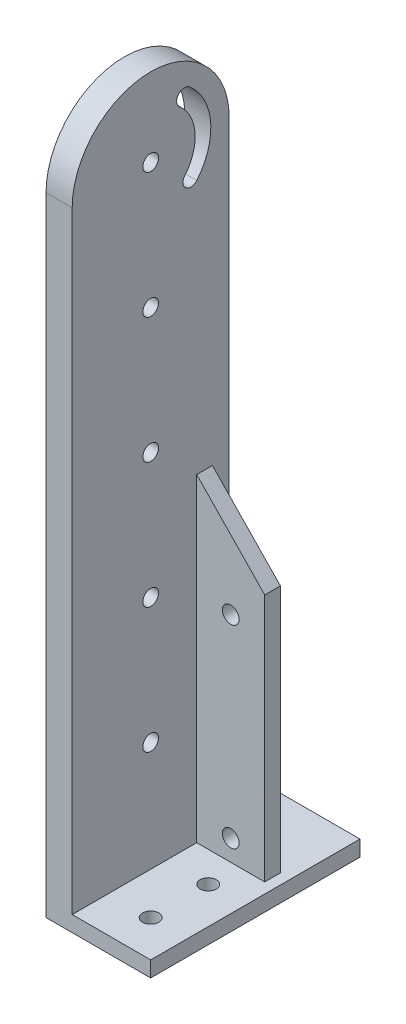
from build123d import *

# Parameters (mm, degrees)
SKETCH_1_R          = 1.5
EXTRUDE_2_DEPTH     = 5
EXTRUDE_3_DEPTH     = 3
SKETCH_5_R          = 1.55
CUT_EXTRUDE_3_DEPTH = 10
SKETCH_6_W          = 3
SKETCH_6_H          = 41
EXTRUDE_4_DEPTH     = 13
EXTRUDE_5_DEPTH     = 3
SKETCH_9_R          = 1.6
CUT_EXTRUDE_4_DEPTH = 3
CUT_EXTRUDE_START   = -1
SKETCH_13_R         = 1.5
CUT_EXTRUDE_6_DEPTH = 1


with BuildPart() as part:
    # 草图1 → 凸台-拉伸2 (new body)
    with BuildSketch(Plane(origin=(0, 0, 0), x_dir=(0, 0, -1), z_dir=(1, 0, 0))):
        with BuildLine():
            Line((-15, 0), (15, 0))
            Line((15, 0), (15, 120))
            ThreePointArc((15, 120), (0, 135), (-15, 120))
            Line((-15, 120), (-15, 0))
        make_face()
        with Locations((0, 24)):
            Circle(SKETCH_1_R, mode=Mode.SUBTRACT)
        with Locations((0, 48)):
            Circle(SKETCH_1_R, mode=Mode.SUBTRACT)
        with Locations((0, 72)):
            Circle(SKETCH_1_R, mode=Mode.SUBTRACT)
        with Locations((0, 96)):
            Circle(SKETCH_1_R, mode=Mode.SUBTRACT)
        with Locations((0, 120)):
            Circle(SKETCH_1_R, mode=Mode.SUBTRACT)
        with BuildLine():
            ThreePointArc((5.491386938, 126.488040498), (5.315506898, 128.602057104), (7.429523504, 128.777937144))
            ThreePointArc((7.429523504, 128.777937144), (11.458348178, 120.977883954), (8.809511096, 112.607942489))
            ThreePointArc((8.809511096, 112.607942489), (6.696263017, 112.423057238), (6.511377767, 114.536305318))
            ThreePointArc((6.511377767, 114.536305318), (8.469213871, 120.722783792), (5.491386938, 126.488040498))
        make_face(mode=Mode.SUBTRACT)
    extrude(amount=-EXTRUDE_2_DEPTH)

    # 草图4 → 凸台-拉伸3 (add)
    with BuildSketch(Plane(origin=(0, 0, 0), x_dir=(-1, 0, 0), z_dir=(0, -1, 0))):
        Polygon((5, -15), (-15, -15), (-15, 25), (8, 25), (8, 15), (5, 15), align=None)
    extrude(amount=-EXTRUDE_3_DEPTH)

    # 草图5 → 切除-拉伸3 (cut)
    with BuildSketch(Plane.XZ):
        with Locations((8, 8)):
            Circle(SKETCH_5_R)
        with Locations((-3, -20)):
            Circle(SKETCH_5_R)
        with Locations((8, -3)):
            Circle(SKETCH_5_R)
    extrude(amount=-CUT_EXTRUDE_3_DEPTH, mode=Mode.SUBTRACT)

    # 草图6 → 凸台-拉伸4 (add)
    with BuildSketch(Plane(origin=(0, 0, 0), x_dir=(0, 0, -1), z_dir=(1, 0, 0))):
        with Locations((10.3, 23.5)):
            Rectangle(SKETCH_6_W, SKETCH_6_H)
    extrude(amount=EXTRUDE_4_DEPTH)

    # 草图8 → 凸台-拉伸5 (add)
    with BuildSketch(Plane(origin=(0, 0, -11.8), x_dir=(-1, 0, 0), z_dir=(0, 0, -1))):
        Polygon((-13, 50.5), (0, 63.933326995), (0, 50.5), (0, 44), (-13, 44), align=None)
    extrude(amount=-EXTRUDE_5_DEPTH)

    # 草图9 → 切除-拉伸4 (cut)
    with BuildSketch(Plane(origin=(0, 0, -11.8), x_dir=(-1, 0, 0), z_dir=(0, 0, -1))):
        with Locations((-6.5, 44)):
            Circle(SKETCH_9_R)
        with Locations((-6.5, 7)):
            Circle(SKETCH_9_R)
    extrude(amount=-CUT_EXTRUDE_4_DEPTH, mode=Mode.SUBTRACT)

    # 草图13 → 切除-拉伸6 (cut)
    with BuildSketch(Plane.ZY.offset(5).offset(CUT_EXTRUDE_START)):
        with BuildLine():
            Line((-10, 96), (-10, 24))
            ThreePointArc((-10, 24), (0, 14), (10, 24))
            Line((10, 24), (10, 96))
            ThreePointArc((10, 96), (0, 106), (-10, 96))
        make_face()
        with Locations((0, 24)):
            Circle(SKETCH_13_R, mode=Mode.SUBTRACT)
        with Locations((0, 48)):
            Circle(SKETCH_13_R, mode=Mode.SUBTRACT)
        with Locations((0, 72)):
            Circle(SKETCH_13_R, mode=Mode.SUBTRACT)
        with Locations((0, 96)):
            Circle(SKETCH_13_R, mode=Mode.SUBTRACT)
    extrude(amount=CUT_EXTRUDE_6_DEPTH, mode=Mode.SUBTRACT)


solid = part.part
